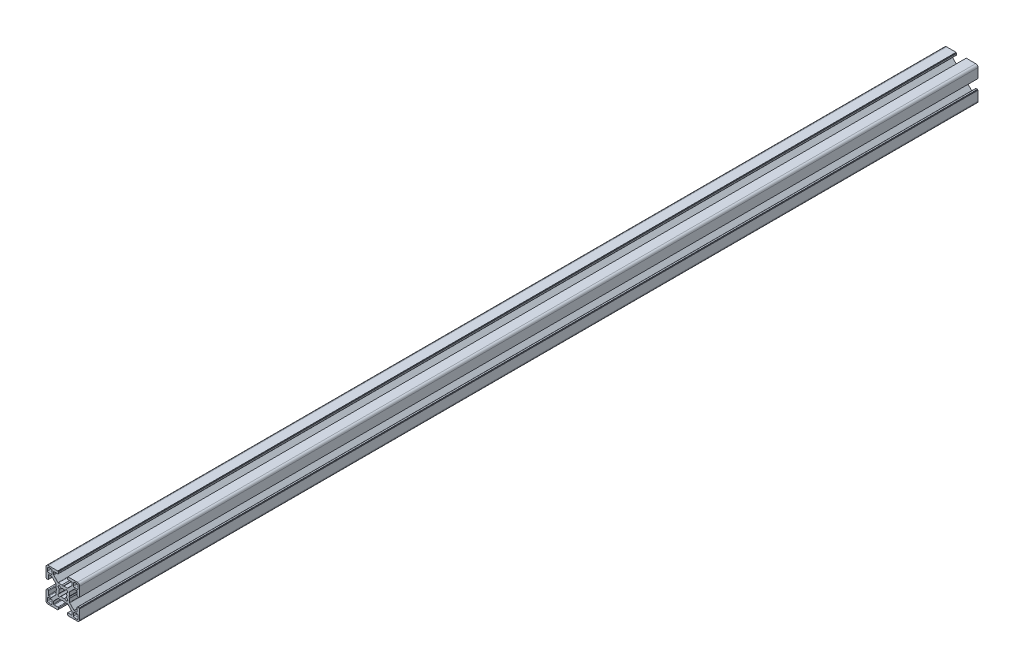
from build123d import *

# Parameters (mm, degrees)
BOSS_EXTRUDE1_DEPTH = 400
CIRPATTERN1_COUNT   = 4


with BuildPart() as part:
    # Sketch3 → Boss-Extrude1 (new, symmetric)
    with BuildSketch(Plane.XY):
        with BuildLine():
            Line((-4.503841895, 3.156803476), (-3.14772708, 1.530298739))
            ThreePointArc((-3.14772708, 1.530298739), (-3.410794979, 0.785160882), (-3.5, 0))
            Line((-3.5, 0), (-5.5, 0))
            Line((-5.5, 0), (-6, 0.866025404))
            Line((-6, 0.866025404), (-6, 3.996841995))
            ThreePointArc((-6, 3.996841995), (-6.038060234, 4.188183711), (-6.146446609, 4.350395385))
            Line((-6.146446609, 4.350395385), (-9.917104615, 8.121053391))
            ThreePointArc((-9.917104615, 8.121053391), (-10.079316289, 8.229439766), (-10.270658005, 8.2675))
            Line((-10.270658005, 8.2675), (-12.29, 8.2675))
            ThreePointArc((-12.29, 8.2675), (-12.643553391, 8.121053391), (-12.79, 7.7675))
            Line((-12.79, 7.7675), (-12.79, 4.5))
            ThreePointArc((-12.79, 4.5), (-12.936446609, 4.146446609), (-13.29, 4))
            Line((-13.29, 4), (-14.5, 4))
            Line((-14.5, 4), (-14.5, 4.5))
            Line((-14.5, 4.5), (-15, 4.5))
            Line((-15, 4.5), (-15, 12.968))
            ThreePointArc((-15, 12.968), (-14.404840979, 14.404840979), (-12.968, 15))
            Line((-12.968, 15), (-4.5, 15))
            Line((-4.5, 15), (-4.5, 14.5))
            Line((-4.5, 14.5), (-4, 14.5))
            Line((-4, 14.5), (-4, 13.29))
            ThreePointArc((-4, 13.29), (-4.146446609, 12.936446609), (-4.5, 12.79))
            Line((-4.5, 12.79), (-7.7675, 12.79))
            ThreePointArc((-7.7675, 12.79), (-8.121053391, 12.643553391), (-8.2675, 12.29))
            Line((-8.2675, 12.29), (-8.2675, 10.270658005))
            ThreePointArc((-8.2675, 10.270658005), (-8.229439766, 10.079316289), (-8.121053391, 9.917104615))
            Line((-8.121053391, 9.917104615), (-4.350395385, 6.146446609))
            ThreePointArc((-4.350395385, 6.146446609), (-4.188183711, 6.038060234), (-3.996841995, 6))
            Line((-3.996841995, 6), (-0.866025404, 6))
            Line((-0.866025404, 6), (0, 5.5))
            Line((0, 5.5), (0, 3.5))
            ThreePointArc((0, 3.5), (-0.785160882, 3.410794979), (-1.530298739, 3.14772708))
            Line((-1.530298739, 3.14772708), (-3.156803476, 4.503841895))
            ThreePointArc((-3.156803476, 4.503841895), (-3.889087297, 3.889087297), (-4.503841895, 3.156803476))
        make_face()
        with BuildLine():
            Line((-12.705, 9.5135), (-10.5135, 9.5135))
            ThreePointArc((-10.5135, 9.5135), (-9.806393219, 9.806393219), (-9.5135, 10.5135))
            Line((-9.5135, 10.5135), (-9.5135, 12.705))
            ThreePointArc((-9.5135, 12.705), (-9.806393219, 13.412106781), (-10.5135, 13.705))
            Line((-10.5135, 13.705), (-12.705, 13.705))
            ThreePointArc((-12.705, 13.705), (-13.412106781, 13.412106781), (-13.705, 12.705))
            Line((-13.705, 12.705), (-13.705, 10.5135))
            ThreePointArc((-13.705, 10.5135), (-13.412106781, 9.806393219), (-12.705, 9.5135))
        make_face(mode=Mode.SUBTRACT)
    boss_extrude1 = extrude(amount=BOSS_EXTRUDE1_DEPTH, both=True)

    # CirPattern1: Boss-Extrude1 ×4 about axis
    cirpattern1_axis = Axis((0, 0, 76.2), (0, 0, -1))
    for i in range(1, CIRPATTERN1_COUNT):
        add(boss_extrude1.rotate(cirpattern1_axis, i * 360 / CIRPATTERN1_COUNT))


solid = part.part
